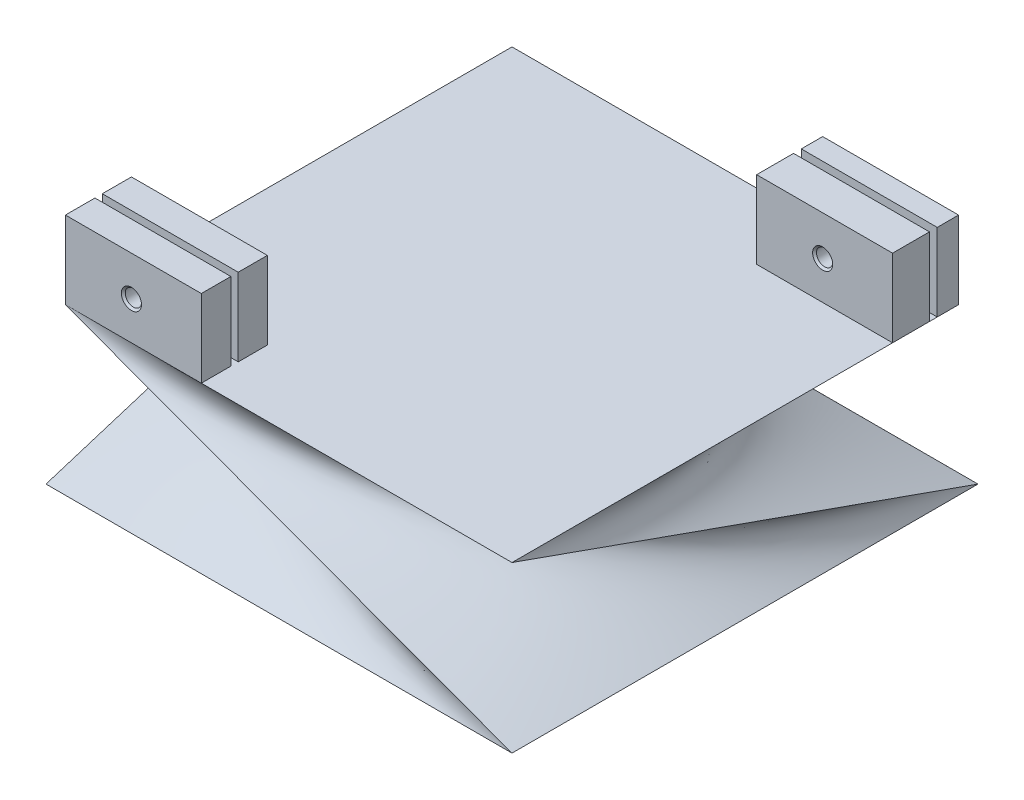
from build123d import *

# Parameters (mm, degrees)
SKETCH20_W                           = 44.45
SKETCH20_H                           = 21.59
BOSS_EXTRUDE3_DEPTH                  = 25.4
SKETCH22_W                           = 44.45
SKETCH22_H                           = 2.413
CUT_EXTRUDE2_DEPTH                   = 25.4
SKETCH23_W                           = 44.45
SKETCH23_H                           = 2.54
CUT_EXTRUDE3_DEPTH                   = 25.4
F_4_0_209_DIAMETER_HOLE6_D           = 5.3086
F_4_0_209_DIAMETER_HOLE6_CSINK_D     = 6.5786
F_4_0_209_DIAMETER_HOLE6_CSINK_ANGLE = 90
F_4_0_209_DIAMETER_HOLE7_D           = 5.3086
F_4_0_209_DIAMETER_HOLE7_CSINK_D     = 6.5786
F_4_0_209_DIAMETER_HOLE7_CSINK_ANGLE = 90


with BuildPart() as part:
    # Loft1: read off the stored shape, not the designer's step
    # Loft1: loft between two sections, ruled curve by curve
    loft1_from = [
        Edge.make_bspline([(-73.025, 50.8, -73.025), (-48.683333333, 50.8, -73.025), (-24.341666667, 50.8, -73.025), (24.341666667, 50.8, -73.025), (48.683333333, 50.8, -73.025), (73.025, 50.8, -73.025)], [0, 0, 0, 0, 0.5, 0.5, 1, 1, 1, 1], 3),
        Edge.make_bspline([(73.025, 50.8, -73.025), (73.025, 50.8, -48.683333333), (73.025, 50.8, -24.341666667), (73.025, 50.8, 24.341666667), (73.025, 50.8, 48.683333333), (73.025, 50.8, 73.025)], [0, 0, 0, 0, 0.5, 0.5, 1, 1, 1, 1], 3),
        Edge.make_bspline([(-73.025, 50.8, 73.025), (-73.025, 50.8, 48.683333333), (-73.025, 50.8, 24.341666667), (-73.025, 50.8, -24.341666667), (-73.025, 50.8, -48.683333333), (-73.025, 50.8, -73.025)], [0, 0, 0, 0, 0.5, 0.5, 1, 1, 1, 1], 3),
        Edge.make_bspline([(73.025, 50.8, 73.025), (48.683333333, 50.8, 73.025), (24.341666667, 50.8, 73.025), (-24.341666667, 50.8, 73.025), (-48.683333333, 50.8, 73.025), (-73.025, 50.8, 73.025)], [0, 0, 0, 0, 0.5, 0.5, 1, 1, 1, 1], 3),
    ]
    loft1_to = [
        Edge.make_bspline([(-76.2, 0, 76.2), (-76.2, 0, 50.8), (-76.2, 0, 25.4), (-76.2, 0, -25.4), (-76.2, 0, -50.8), (-76.2, 0, -76.2)], [0, 0, 0, 0, 0.5, 0.5, 1, 1, 1, 1], 3),
        Edge.make_bspline([(-76.2, 0, -76.2), (-50.8, 0, -76.2), (-25.4, 0, -76.2), (25.4, 0, -76.2), (50.8, 0, -76.2), (76.2, 0, -76.2)], [0, 0, 0, 0, 0.5, 0.5, 1, 1, 1, 1], 3),
        Edge.make_bspline([(76.2, 0, 76.2), (50.8, 0, 76.2), (25.4, 0, 76.2), (-25.4, 0, 76.2), (-50.8, 0, 76.2), (-76.2, 0, 76.2)], [0, 0, 0, 0, 0.5, 0.5, 1, 1, 1, 1], 3),
        Edge.make_bspline([(76.2, 0, -76.2), (76.2, 0, -50.8), (76.2, 0, -25.4), (76.2, 0, 25.4), (76.2, 0, 50.8), (76.2, 0, 76.2)], [0, 0, 0, 0, 0.5, 0.5, 1, 1, 1, 1], 3),
    ]
    loft1 = Solid(Shell([*[Face.make_surface_from_curves(loft1_from[k], loft1_to[k]) for k in range(4)], Face(Wire(loft1_from)), Face(Wire(loft1_to))]))
    add(loft1)

    # Sketch20 → Boss-Extrude3 (add)
    with BuildSketch(Plane(origin=(0, 50.8, 0), x_dir=(1, 0, 0), z_dir=(0, 1, 0))):
        with Locations((-50.8, -62.23)):
            Rectangle(SKETCH20_W, SKETCH20_H)
        with Locations((50.8, 62.23)):
            Rectangle(SKETCH20_W, SKETCH20_H)
    extrude(amount=BOSS_EXTRUDE3_DEPTH)

    # Sketch22 → Cut-Extrude2 (cut)
    with BuildSketch(Plane(origin=(0, 76.2, 0), x_dir=(1, 0, 0), z_dir=(0, 1, 0))):
        with Locations((-50.8, -62.1665)):
            Rectangle(SKETCH22_W, SKETCH22_H)
    extrude(amount=-CUT_EXTRUDE2_DEPTH, mode=Mode.SUBTRACT)

    # Sketch23 → Cut-Extrude3 (cut)
    with BuildSketch(Plane(origin=(0, 76.2, 0), x_dir=(1, 0, 0), z_dir=(0, 1, 0))):
        with Locations((50.8, 64.77)):
            Rectangle(SKETCH23_W, SKETCH23_H)
    extrude(amount=-CUT_EXTRUDE3_DEPTH, mode=Mode.SUBTRACT)

    # #4 (0.209) Diameter Hole6 (through all)
    with Locations(Plane.XY.offset(73.025)):
        with Locations((-51.435, 63.246)):
            CounterSinkHole(F_4_0_209_DIAMETER_HOLE6_D / 2, F_4_0_209_DIAMETER_HOLE6_CSINK_D / 2, counter_sink_angle=F_4_0_209_DIAMETER_HOLE6_CSINK_ANGLE)

    # #4 (0.209) Diameter Hole7 (through all)
    with Locations(Plane.XY.offset(-51.435)):
        with Locations((50.165, 63.246)):
            CounterSinkHole(F_4_0_209_DIAMETER_HOLE7_D / 2, F_4_0_209_DIAMETER_HOLE7_CSINK_D / 2, counter_sink_angle=F_4_0_209_DIAMETER_HOLE7_CSINK_ANGLE)


solid = part.part
